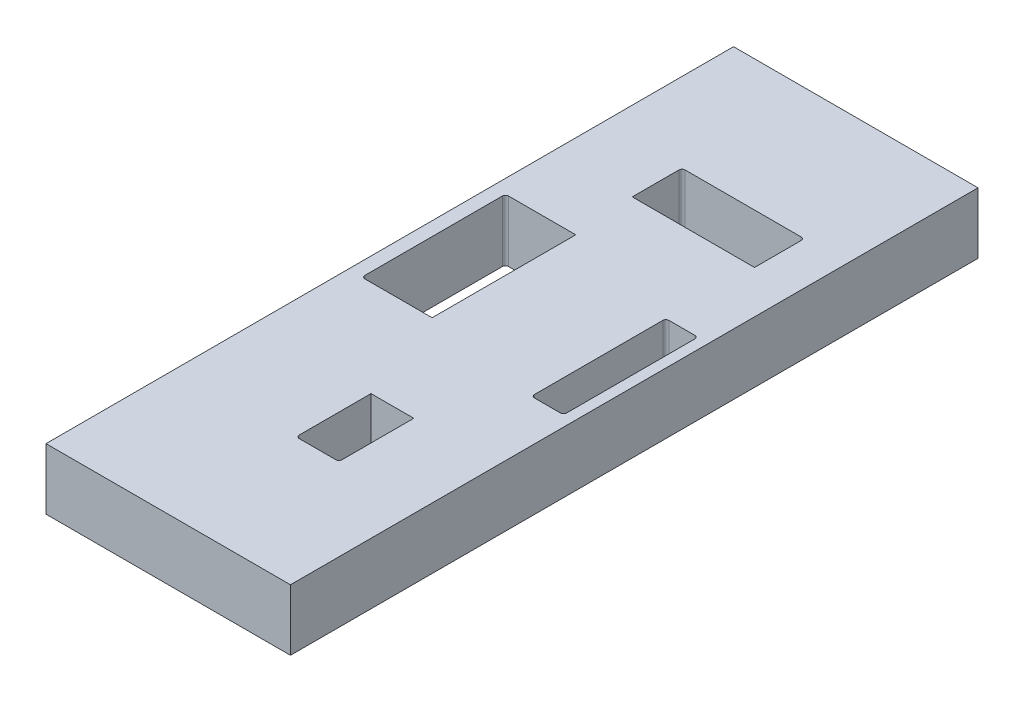
from build123d import *

# Parameters (mm, degrees)
SKETCH1_W           = 80
SKETCH1_H           = 225
BOSS_EXTRUDE1_DEPTH = 20
CUT_EXTRUDE1_REACH  = 125.176
CUT_EXTRUDE2_REACH  = 125.176
CUT_EXTRUDE3_REACH  = 125.176
CUT_EXTRUDE4_REACH  = 125.176


with BuildPart() as part:
    # Sketch1 → Boss-Extrude1 (new body)
    with BuildSketch(Plane(origin=(0, 0, 0), x_dir=(1, 0, 0), z_dir=(0, 1, 0))):
        with Locations((-6, 0)):
            Rectangle(SKETCH1_W, SKETCH1_H)
    extrude(amount=-BOSS_EXTRUDE1_DEPTH)

    # Sketch2 → Cut-Extrude1 (cut, up to next)
    with BuildSketch(Plane(origin=(0, 0, 0), x_dir=(1, 0, 0), z_dir=(0, 1, 0)), mode=Mode.PRIVATE) as cut_extrude1_sk1:
        with BuildLine():
            Line((21, -19.64), (29.5, -19.64))
            ThreePointArc((29.5, -19.64), (30.207106781, -19.347106781), (30.5, -18.64))
            Line((30.5, -18.64), (30.5, 23.36))
            ThreePointArc((30.5, 23.36), (30.207106781, 24.067106781), (29.5, 24.36))
            Line((29.5, 24.36), (21, 24.36))
            ThreePointArc((21, 24.36), (20.292893219, 24.067106781), (20, 23.36))
            Line((20, 23.36), (20, -18.64))
            ThreePointArc((20, -18.64), (20.292893219, -19.347106781), (21, -19.64))
        make_face()
    cut_extrude1_tool1 = extrude(cut_extrude1_sk1.sketch, amount=-CUT_EXTRUDE1_REACH, mode=Mode.PRIVATE) & part.part
    add(cut_extrude1_tool1.solids().sort_by_distance((25.25, 0, -2.36))[0], mode=Mode.SUBTRACT)

    # Sketch4 → Cut-Extrude2 (cut, up to next)
    with BuildSketch(Plane(origin=(0, 0, 0), x_dir=(1, 0, 0), z_dir=(0, 1, 0)), mode=Mode.PRIVATE) as cut_extrude2_sk1:
        with BuildLine():
            Line((7, -68.64), (7, -45.14))
            Line((7, -45.14), (-7, -45.14))
            Line((-7, -45.14), (-7, -68.64))
            ThreePointArc((-7, -68.64), (-6.707106781, -69.347106781), (-6, -69.64))
            Line((-6, -69.64), (6, -69.64))
            ThreePointArc((6, -69.64), (6.707106781, -69.347106781), (7, -68.64))
        make_face()
    cut_extrude2_tool1 = extrude(cut_extrude2_sk1.sketch, amount=-CUT_EXTRUDE2_REACH, mode=Mode.PRIVATE) & part.part
    add(cut_extrude2_tool1.solids().sort_by_distance((0, 0, 57.374932))[0], mode=Mode.SUBTRACT)

    # Sketch5 → Cut-Extrude3 (cut, up to next)
    with BuildSketch(Plane(origin=(0, 0, 0), x_dir=(1, 0, 0), z_dir=(0, 1, 0)), mode=Mode.PRIVATE) as cut_extrude3_sk1:
        with BuildLine():
            Line((-18.5, -13.64), (-18.5, 33.36))
            Line((-18.5, 33.36), (-40.5, 33.36))
            ThreePointArc((-40.5, 33.36), (-41.207106781, 33.067106781), (-41.5, 32.36))
            Line((-41.5, 32.36), (-41.5, -12.64))
            ThreePointArc((-41.5, -12.64), (-41.207106781, -13.347106781), (-40.5, -13.64))
            Line((-40.5, -13.64), (-18.5, -13.64))
        make_face()
    cut_extrude3_tool1 = extrude(cut_extrude3_sk1.sketch, amount=-CUT_EXTRUDE3_REACH, mode=Mode.PRIVATE) & part.part
    add(cut_extrude3_tool1.solids().sort_by_distance((-29.995521, 0, -9.86))[0], mode=Mode.SUBTRACT)

    # Sketch6 → Cut-Extrude4 (cut, up to next)
    with BuildSketch(Plane(origin=(0, 0, 0), x_dir=(1, 0, 0), z_dir=(0, 1, 0)), mode=Mode.PRIVATE) as cut_extrude4_sk1:
        with BuildLine():
            Line((19, 69.64), (-19, 69.64))
            ThreePointArc((-19, 69.64), (-19.707106781, 69.347106781), (-20, 68.64))
            Line((-20, 68.64), (-20, 53.36))
            Line((-20, 53.36), (20, 53.36))
            Line((20, 53.36), (20, 68.64))
            ThreePointArc((20, 68.64), (19.707106781, 69.347106781), (19, 69.64))
        make_face()
    cut_extrude4_tool1 = extrude(cut_extrude4_sk1.sketch, amount=-CUT_EXTRUDE4_REACH, mode=Mode.PRIVATE) & part.part
    add(cut_extrude4_tool1.solids().sort_by_distance((0, 0, -61.494779))[0], mode=Mode.SUBTRACT)


solid = part.part
